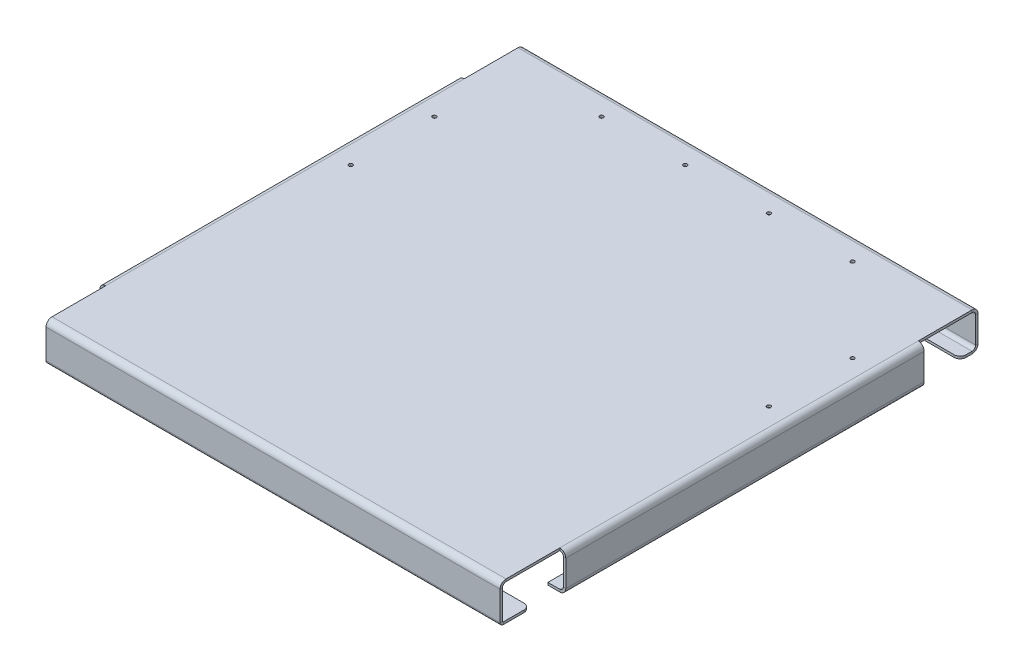
from build123d import *

# Parameters (mm, degrees)
SKETCH1_W                     = 380
SKETCH1_H                     = 390
BASE_FLANGE1_DEPTH            = 2
EDGE_FLANGE3_DEPTH            = 380
EDGE_FLANGE11_DEPTH           = 380
EDGE_FLANGE12_STRIP_W         = 14
EDGE_FLANGE12_STRIP_H         = 2
EDGE_FLANGE12_STRIP_CUT_DEPTH = 380
EDGE_FLANGE12_DEPTH           = 380
EDGE_FLANGE13_STRIP_W         = 9.4732
EDGE_FLANGE13_STRIP_H         = 2
EDGE_FLANGE13_STRIP_CUT_DEPTH = 380
EDGE_FLANGE13_DEPTH           = 380
F_1_0MM_DOWEL_HOLE2_D         = 3.2
FILLET1_R                     = 5
EDGE_FLANGE14_DEPTH           = 300
EDGE_FLANGE15_DEPTH           = 300
EDGE_FLANGE16_STRIP_W         = 14
EDGE_FLANGE16_STRIP_H         = 2
EDGE_FLANGE16_STRIP_CUT_DEPTH = 300
EDGE_FLANGE16_DEPTH           = 300
EDGE_FLANGE17_STRIP_W         = 14
EDGE_FLANGE17_STRIP_H         = 2
EDGE_FLANGE17_STRIP_CUT_DEPTH = 300
EDGE_FLANGE17_DEPTH           = 300


# Sheet-metal steps are written as plain solids
with BuildPart() as part:
    # Sketch1 → Base-Flange1 (new body)
    with BuildSketch(Plane(origin=(0, 0, 0), x_dir=(1, 0, 0), z_dir=(0, 1, 0))):
        Rectangle(SKETCH1_W, SKETCH1_H)
    extrude(amount=-BASE_FLANGE1_DEPTH)

    # Edge-Flange3 section (across the edge) → Edge-Flange3 (add)
    with BuildSketch(Plane(origin=(-190, -2, -198), x_dir=(0, 0, 1), z_dir=(1, 0, 0))):
        with BuildLine():
            Line((-2, 3), (-2, 28))
            Line((-2, 28), (0, 28))
            Line((0, 28), (0, 3))
            ThreePointArc((0, 3), (0.878679656, 0.878679656), (3, 0))
            Line((3, 0), (3, -2))
            ThreePointArc((3, -2), (-0.535533906, -0.535533906), (-2, 3))
        make_face()
    extrude(amount=EDGE_FLANGE3_DEPTH)

    # Edge-Flange11 section (across the edge) → Edge-Flange11 (add)
    with BuildSketch(Plane(origin=(190, -2, 198), x_dir=(0, 0, -1), z_dir=(-1, 0, 0))):
        with BuildLine():
            Line((-2, 3), (-2, 28))
            Line((-2, 28), (0, 28))
            Line((0, 28), (0, 3))
            ThreePointArc((0, 3), (0.878679656, 0.878679656), (3, 0))
            Line((3, 0), (3, -2))
            ThreePointArc((3, -2), (-0.535533906, -0.535533906), (-2, 3))
        make_face()
    extrude(amount=EDGE_FLANGE11_DEPTH)

    # Edge-Flange12 strip (across the edge) → Edge-Flange12 strip cut (cut)
    with BuildSketch(Plane(origin=(-190, -30, -198), x_dir=(0, 1, 0), z_dir=(1, 0, 0))):
        with Locations((-4, -1)):
            Rectangle(EDGE_FLANGE12_STRIP_W, EDGE_FLANGE12_STRIP_H)
    extrude(amount=EDGE_FLANGE12_STRIP_CUT_DEPTH, mode=Mode.SUBTRACT)

    # Edge-Flange12 section (across the edge) → Edge-Flange12 (add)
    with BuildSketch(Plane(origin=(-190, -30, -198), x_dir=(0, 1, 0), z_dir=(1, 0, 0))):
        with BuildLine():
            Line((-2, 3), (-2, 13))
            Line((-2, 13), (0, 13))
            Line((0, 13), (0, 3))
            ThreePointArc((0, 3), (0.878679656, 0.878679656), (3, 0))
            Line((3, 0), (3, -2))
            ThreePointArc((3, -2), (-0.535533906, -0.535533906), (-2, 3))
        make_face()
    extrude(amount=EDGE_FLANGE12_DEPTH)

    # Edge-Flange13 strip (across the edge) → Edge-Flange13 strip cut (cut)
    with BuildSketch(Plane(origin=(190, -30, 198), x_dir=(0, 1, 0), z_dir=(-1, 0, 0))):
        with Locations((-4, -1)):
            Rectangle(EDGE_FLANGE13_STRIP_W, EDGE_FLANGE13_STRIP_H)
    extrude(amount=EDGE_FLANGE13_STRIP_CUT_DEPTH, mode=Mode.SUBTRACT)

    # Edge-Flange13 section (across the edge) → Edge-Flange13 (add)
    with BuildSketch(Plane(origin=(190, -30, 198), x_dir=(0, 1, 0), z_dir=(-1, 0, 0))):
        with BuildLine():
            Line((-2, 0.7366), (-2, 23))
            Line((-2, 23), (0, 23))
            Line((0, 23), (0, 0.7366))
            ThreePointArc((0, 0.7366), (0.215745145, 0.215745145), (0.7366, 0))
            Line((0.7366, 0), (0.7366, -2))
            ThreePointArc((0.7366, -2), (-1.198468417, -1.198468417), (-2, 0.7366))
        make_face()
    extrude(amount=EDGE_FLANGE13_DEPTH)

    # Ø1.0mm Dowel Hole2 (through all)
    with Locations(Plane(origin=(0, 0, 0), x_dir=(1, 0, 0), z_dir=(0, 1, 0))):
        with Locations((-175, 40), (-175, 110), (-105, 180), (-35, 180), (35, 180), (175, 110), (175, 40), (105, 180)):
            Hole(F_1_0MM_DOWEL_HOLE2_D / 2)

    # Fillet1
    fillet1_edges = [part.edges().sort_by_distance(p)[0] for p in [
        (190, -31, 175),
        (-190, -31, 175),
        (-190, -31, -185),
        (190, -31, -185),
    ]]
    fillet(fillet1_edges, radius=FILLET1_R)

    # Edge-Flange14 section (across the edge) → Edge-Flange14 (add)
    with BuildSketch(Plane(origin=(193, -2, -150), x_dir=(-1, 0, 0), z_dir=(0, 0, 1))):
        with BuildLine():
            Line((-2, 3), (-2, 30))
            Line((-2, 30), (0, 30))
            Line((0, 30), (0, 3))
            ThreePointArc((0, 3), (0.878679656, 0.878679656), (3, 0))
            Line((3, 0), (3, -2))
            ThreePointArc((3, -2), (-0.535533906, -0.535533906), (-2, 3))
        make_face()
    extrude(amount=EDGE_FLANGE14_DEPTH)

    # Edge-Flange15 section (across the edge) → Edge-Flange15 (add)
    with BuildSketch(Plane(origin=(-193, -2, 150), x_dir=(1, 0, 0), z_dir=(0, 0, -1))):
        with BuildLine():
            Line((-2, 3), (-2, 30))
            Line((-2, 30), (0, 30))
            Line((0, 30), (0, 3))
            ThreePointArc((0, 3), (0.878679656, 0.878679656), (3, 0))
            Line((3, 0), (3, -2))
            ThreePointArc((3, -2), (-0.535533906, -0.535533906), (-2, 3))
        make_face()
    extrude(amount=EDGE_FLANGE15_DEPTH)

    # Edge-Flange16 strip (across the edge) → Edge-Flange16 strip cut (cut)
    with BuildSketch(Plane(origin=(193, -32, -150), x_dir=(0, 1, 0), z_dir=(0, 0, 1))):
        with Locations((-2, -1)):
            Rectangle(EDGE_FLANGE16_STRIP_W, EDGE_FLANGE16_STRIP_H)
    extrude(amount=EDGE_FLANGE16_STRIP_CUT_DEPTH, mode=Mode.SUBTRACT)

    # Edge-Flange16 section (across the edge) → Edge-Flange16 (add)
    with BuildSketch(Plane(origin=(193, -32, -150), x_dir=(0, 1, 0), z_dir=(0, 0, 1))):
        with BuildLine():
            Line((0, 3), (0, 13))
            Line((0, 13), (2, 13))
            Line((2, 13), (2, 3))
            ThreePointArc((2, 3), (2.878679656, 0.878679656), (5, 0))
            Line((5, 0), (5, -2))
            ThreePointArc((5, -2), (1.464466094, -0.535533906), (0, 3))
        make_face()
    extrude(amount=EDGE_FLANGE16_DEPTH)

    # Edge-Flange17 strip (across the edge) → Edge-Flange17 strip cut (cut)
    with BuildSketch(Plane(origin=(-193, -32, 150), x_dir=(0, 1, 0), z_dir=(0, 0, -1))):
        with Locations((-2, -1)):
            Rectangle(EDGE_FLANGE17_STRIP_W, EDGE_FLANGE17_STRIP_H)
    extrude(amount=EDGE_FLANGE17_STRIP_CUT_DEPTH, mode=Mode.SUBTRACT)

    # Edge-Flange17 section (across the edge) → Edge-Flange17 (add)
    with BuildSketch(Plane(origin=(-193, -32, 150), x_dir=(0, 1, 0), z_dir=(0, 0, -1))):
        with BuildLine():
            Line((0, 3), (0, 13))
            Line((0, 13), (2, 13))
            Line((2, 13), (2, 3))
            ThreePointArc((2, 3), (2.878679656, 0.878679656), (5, 0))
            Line((5, 0), (5, -2))
            ThreePointArc((5, -2), (1.464466094, -0.535533906), (0, 3))
        make_face()
    extrude(amount=EDGE_FLANGE17_DEPTH)


solid = part.part
